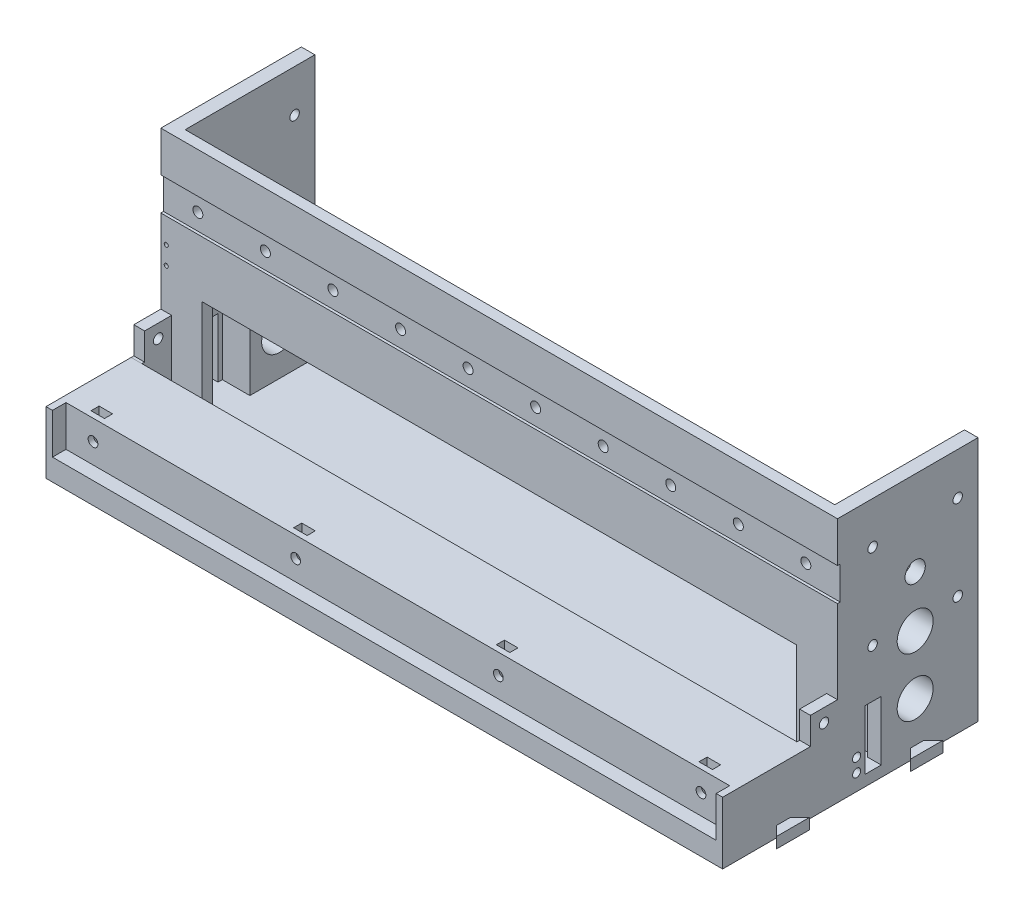
from build123d import *

# Parameters (mm, degrees)
SKETCH21_W                   = 250.4
SKETCH21_H                   = 94.5
BASE_DEPTH                   = 4
SKETCH22_W                   = 250.4
SKETCH22_H                   = 4
MAINWALL_DEPTH               = 87
SKETCH2_W                    = 250.4
SKETCH2_H                    = 12.2
RAILCUTOUT_DEPTH             = 1
SKETCH6_W                    = 220
SKETCH6_H                    = 20
PAPERCHANNEL_DEPTH           = 5
SKETCH3_R                    = 1.85
RAILSCREWHOLE_DEPTH          = 4
RAILSCREWPATTERN_COUNT       = 10
RAILSCREWPATTERN_PITCH       = 25
SKETCH13_W                   = 48
SKETCH13_H                   = 87
YWALL_DEPTH                  = 5
SKETCH20_W                   = 250.4
SKETCH20_H                   = 42.5
BASEEXTENSION_DEPTH          = 19
SKETCH14_R                   = 6.65
SKETCH14_R_2                 = 3.75
SKETCH14_R_3                 = 1.75
MOTORSCREWBEARINGHOLES_DEPTH = 5
SKETCH26_R                   = 6.65
LEFTROLLEROFFSET_DEPTH       = 10.2
CHAMFER2_SIZE                = 15
RIGHTROLLEROFFSET_START      = 10
SKETCH28_R                   = 6.65
RIGHTROLLEROFFSET_DEPTH      = 10
SKETCH29_R                   = 1.75
BACKMOUNTSCREW_DEPTH         = 4
DOVETAILS_LEFT_DEPTH         = 4
DOVETAILS_LEFT_2_DEPTH       = 4
DOVETAILS_RIGHT_DEPTH        = 4
SKETCH43_R                   = 0.75
ENDSTOP_SCREW_HOLES_DEPTH    = 4
SKETCH44_R                   = 1.5
SKETCH44_W                   = 6
SKETCH44_H                   = 22
CABLE_PASSTHROUGH_DEPTH      = 5
SKETCH46_W                   = 245.6
SKETCH46_H                   = 5
CHANNEL_CUTOUT_DEPTH         = 15
SKETCH47_R                   = 1.8
CHANNEL_SCREW_HOLE_DEPTH     = 4
SKETCH48_W                   = 5
SKETCH48_H                   = 3
CHANNEL_NUT_HOLE_DEPTH       = 11.3
LPATTERN1_COUNT              = 4
LPATTERN1_PITCH              = 75


with BuildPart() as part:
    # Sketch21 → Base (new body)
    with BuildSketch(Plane(origin=(0, 0, 0), x_dir=(1, 0, 0), z_dir=(0, 1, 0))):
        with Locations((125.2, -47.25)):
            Rectangle(SKETCH21_W, SKETCH21_H)
    extrude(amount=BASE_DEPTH)

    # Sketch22 → MainWall (add)
    with BuildSketch(Plane(origin=(0, 4, 0), x_dir=(1, 0, 0), z_dir=(0, 1, 0))):
        with Locations((125.2, -50)):
            Rectangle(SKETCH22_W, SKETCH22_H)
    extrude(amount=MAINWALL_DEPTH)

    # Sketch2 → RailCutout (cut)
    with BuildSketch(Plane.XY.offset(52)):
        with Locations((125.2, 69.9)):
            Rectangle(SKETCH2_W, SKETCH2_H)
    extrude(amount=-RAILCUTOUT_DEPTH, mode=Mode.SUBTRACT)

    # Sketch6 → PaperChannel (cut)
    with BuildSketch(Plane.XY.offset(52)):
        with Locations((125.2, 33)):
            Rectangle(SKETCH6_W, SKETCH6_H)
    extrude(amount=-PAPERCHANNEL_DEPTH, mode=Mode.SUBTRACT)

    # Sketch3 → RailScrewHole (cut)
    with BuildSketch(Plane.XY.offset(51)):
        with Locations((237.7, 69.9)):
            Circle(SKETCH3_R)
    railscrewhole = extrude(amount=-RAILSCREWHOLE_DEPTH, mode=Mode.SUBTRACT)

    # RailScrewPattern: RailScrewHole ×10
    with Locations(*[(-i * RAILSCREWPATTERN_PITCH, 0, 0) for i in range(1, RAILSCREWPATTERN_COUNT)]):
        add(railscrewhole, mode=Mode.SUBTRACT)

    # Sketch13 → YWall (add)
    with BuildSketch(Plane(origin=(0, 0, 0), x_dir=(0, 0, -1), z_dir=(1, 0, 0))):
        with Locations((-24, 47.5)):
            Rectangle(SKETCH13_W, SKETCH13_H)
    ywall = extrude(amount=YWALL_DEPTH)

    # Sketch20 → BaseExtension (add)
    with BuildSketch(Plane(origin=(0, 4, 0), x_dir=(1, 0, 0), z_dir=(0, 1, 0))):
        with Locations((125.2, -73.25)):
            Rectangle(SKETCH20_W, SKETCH20_H)
    extrude(amount=BASEEXTENSION_DEPTH)

    # Sketch14 → MotorScrewBearingHoles (cut)
    with BuildSketch(Plane(origin=(0, 0, 0), x_dir=(0, 0, -1), z_dir=(1, 0, 0))):
        with Locations((-23.25, 19)):
            Circle(SKETCH14_R)
        with Locations((-23.25, 40.65)):
            Circle(SKETCH14_R)
        with Locations((-23.25, 59.65)):
            Circle(SKETCH14_R_2)
        with Locations((-7.5, 43.9)):
            Circle(SKETCH14_R_3)
        with Locations((-7.5, 75.4)):
            Circle(SKETCH14_R_3)
        with Locations((-39, 75.4)):
            Circle(SKETCH14_R_3)
        with Locations((-39, 43.9)):
            Circle(SKETCH14_R_3)
    motorscrewbearingholes = extrude(amount=MOTORSCREWBEARINGHOLES_DEPTH, mode=Mode.SUBTRACT)

    # MirrorYWallHoles: YWall, MotorScrewBearingHoles across plane
    add(ywall.mirror(Plane.ZY.offset(-125.2)))
    add(motorscrewbearingholes.mirror(Plane.ZY.offset(-125.2)), mode=Mode.SUBTRACT)

    # Sketch26 → LeftRollerOffset (add)
    with BuildSketch(Plane(origin=(5, 0, 0), x_dir=(0, 0, -1), z_dir=(1, 0, 0))):
        with BuildLine():
            Line((-34.25, 4), (-12.25, 4))
            Line((-12.25, 4), (-12.25, 43.15))
            ThreePointArc((-12.25, 43.15), (-14.446699141, 48.453300859), (-19.75, 50.65))
            Line((-19.75, 50.65), (-26.75, 50.65))
            ThreePointArc((-26.75, 50.65), (-32.053300859, 48.453300859), (-34.25, 43.15))
            Line((-34.25, 43.15), (-34.25, 4))
        make_face()
        with Locations((-23.25, 19)):
            Circle(SKETCH26_R, mode=Mode.SUBTRACT)
        with Locations((-23.25, 40.65)):
            Circle(SKETCH26_R, mode=Mode.SUBTRACT)
    extrude(amount=LEFTROLLEROFFSET_DEPTH)

    # Chamfer2
    # the kernel refuses this chamfer: 15 mm, written as the material it takes off along each edge
    with BuildSketch(Plane(origin=(273.775244819, 23, 48), x_dir=(0, 0.02749587661058632, 0.9996219169112968), z_dir=(-1, 0, 0))) as chamfer2_piece_1_section:
        Polygon((CHAMFER2_SIZE * 0.999621916911, -CHAMFER2_SIZE * 0.0274958766106), (-CHAMFER2_SIZE * 0.0274958766106, -CHAMFER2_SIZE * 0.999621916911), (0, 0), align=None)
    chamfer2_piece_1 = extrude(amount=297.150489639, mode=Mode.PRIVATE)
    chamfer2_piece_1 = split(chamfer2_piece_1, bisect_by=Plane(origin=(247.9, 19.333333333, 52), z_dir=(0, 0, 1)), keep=Keep.TOP, mode=Mode.PRIVATE)
    add(chamfer2_piece_1, mode=Mode.SUBTRACT)
    with BuildSketch(Plane(origin=(235.2, 23, 48), x_dir=(0, 0.02749587661058632, 0.9996219169112968), z_dir=(-1, 0, 0))) as chamfer2_piece_2:
        Polygon((CHAMFER2_SIZE * 0.999621916911, -CHAMFER2_SIZE * 0.0274958766106), (-CHAMFER2_SIZE * 0.0274958766106, -CHAMFER2_SIZE * 0.999621916911), (0, 0), align=None)
    extrude(amount=220, mode=Mode.SUBTRACT)

    # Sketch28 → RightRollerOffset (add)
    with BuildSketch(Plane.ZY.offset(-245.4).offset(RIGHTROLLEROFFSET_START)):
        with BuildLine():
            Line((19.75, 50.65), (26.75, 50.65))
            ThreePointArc((26.75, 50.65), (32.053300859, 48.453300859), (34.25, 43.15))
            Line((34.25, 43.15), (34.25, 4))
            Line((34.25, 4), (12.25, 4))
            Line((12.25, 4), (12.25, 43.15))
            ThreePointArc((12.25, 43.15), (14.446699141, 48.453300859), (19.75, 50.65))
        make_face()
        with Locations(Location((23.25, 40.65, 0), (0, 0, 180))):
            Circle(SKETCH28_R, mode=Mode.SUBTRACT)
        with Locations(Location((23.25, 19, 0), (0, 0, 180))):
            Circle(SKETCH28_R, mode=Mode.SUBTRACT)
    extrude(amount=-RIGHTROLLEROFFSET_DEPTH)


with BuildPart() as body_2:
    # Sketch29 → BackMountScrew (new body)
    with BuildSketch(Plane.ZY):
        Polygon((52, 23), (52, 33), (62, 33), (62, 23), (63, 23), (52, 12), align=None)
        with Locations((57, 28)):
            Circle(SKETCH29_R, mode=Mode.SUBTRACT)
    backmountscrew = extrude(amount=-BACKMOUNTSCREW_DEPTH)


with BuildPart() as part_1:
    add(part.part)

    # Mirror5: BackMountScrew across plane
    add(backmountscrew.mirror(Plane.ZY.offset(-125.2)))

    # Sketch49 → Dovetails_Right (add)
    with BuildSketch(Plane.XZ):
        Polygon((250.4, 74.5), (253.935533906, 78.035533906), (253.935533906, 65.964466094), (250.4, 69.5), align=None)
        Polygon((250.4, 25), (250.4, 20), (253.935533906, 16.464466094), (253.935533906, 28.535533906), align=None)
    extrude(amount=-DOVETAILS_RIGHT_DEPTH)

    # Sketch43 → Endstop_Screw_Holes (cut)
    with BuildSketch(Plane.XY.offset(52)):
        with Locations((2, 54.6)):
            Circle(SKETCH43_R)
        with Locations((2, 47.9)):
            Circle(SKETCH43_R)
    extrude(amount=-ENDSTOP_SCREW_HOLES_DEPTH, mode=Mode.SUBTRACT)

    # Sketch44 → Cable_Passthrough (cut)
    with BuildSketch(Plane(origin=(5, 0, 0), x_dir=(0, 0, -1), z_dir=(1, 0, 0))):
        with Locations((-44.916666667, 11)):
            Circle(SKETCH44_R)
        with Locations((-44.916666667, 6)):
            Circle(SKETCH44_R)
        with Locations((-38.833333333, 15)):
            Rectangle(SKETCH44_W, SKETCH44_H)
    cable_passthrough = extrude(amount=-CABLE_PASSTHROUGH_DEPTH, mode=Mode.SUBTRACT)

    # Cabble_Passthrough_Mirror: Cable_Passthrough across plane
    add(cable_passthrough.mirror(Plane.ZY.offset(-125.2)), mode=Mode.SUBTRACT)

    # Sketch46 → Channel_Cutout (cut)
    with BuildSketch(Plane(origin=(0, 23, 0), x_dir=(1, 0, 0), z_dir=(0, 1, 0))):
        with Locations((125.2, -92)):
            Rectangle(SKETCH46_W, SKETCH46_H)
    extrude(amount=-CHANNEL_CUTOUT_DEPTH, mode=Mode.SUBTRACT)

    # Sketch47 → Channel_Screw_Hole (cut)
    with BuildSketch(Plane.XY.offset(89.5)):
        with Locations((12.4, 15.5)):
            Circle(SKETCH47_R)
    channel_screw_hole = extrude(amount=-CHANNEL_SCREW_HOLE_DEPTH, mode=Mode.SUBTRACT)

    # Sketch48 → Channel_Nut_Hole (cut)
    with BuildSketch(Plane(origin=(0, 23, 0), x_dir=(1, 0, 0), z_dir=(0, 1, 0))):
        with Locations((12.15, -86)):
            Rectangle(SKETCH48_W, SKETCH48_H)
    channel_nut_hole = extrude(amount=-CHANNEL_NUT_HOLE_DEPTH, mode=Mode.SUBTRACT)

    # LPattern1: Channel_Screw_Hole, Channel_Nut_Hole ×4
    with Locations(*[(i * LPATTERN1_PITCH, 0, 0) for i in range(1, LPATTERN1_COUNT)]):
        add(channel_screw_hole, mode=Mode.SUBTRACT)
        add(channel_nut_hole, mode=Mode.SUBTRACT)


with BuildPart() as body_3:
    # Sketch34 → Dovetails_Left (new body)
    with BuildSketch(Plane.XZ):
        Polygon((0, 64.75), (-3.535533906, 68.285533906), (-3.535533906, 56.214466094), (0, 59.75), align=None)
    extrude(amount=-DOVETAILS_LEFT_DEPTH)


with BuildPart() as body_4:
    # Sketch34 → Dovetails_Left 2 (new body)
    with BuildSketch(Plane.XZ):
        Polygon((-3.535533906, 38.285533906), (0, 34.75), (0, 29.75), (-3.535533906, 26.214466094), align=None)
    extrude(amount=-DOVETAILS_LEFT_2_DEPTH)


solid = Compound([body_2.part, part_1.part, body_3.part, body_4.part])
